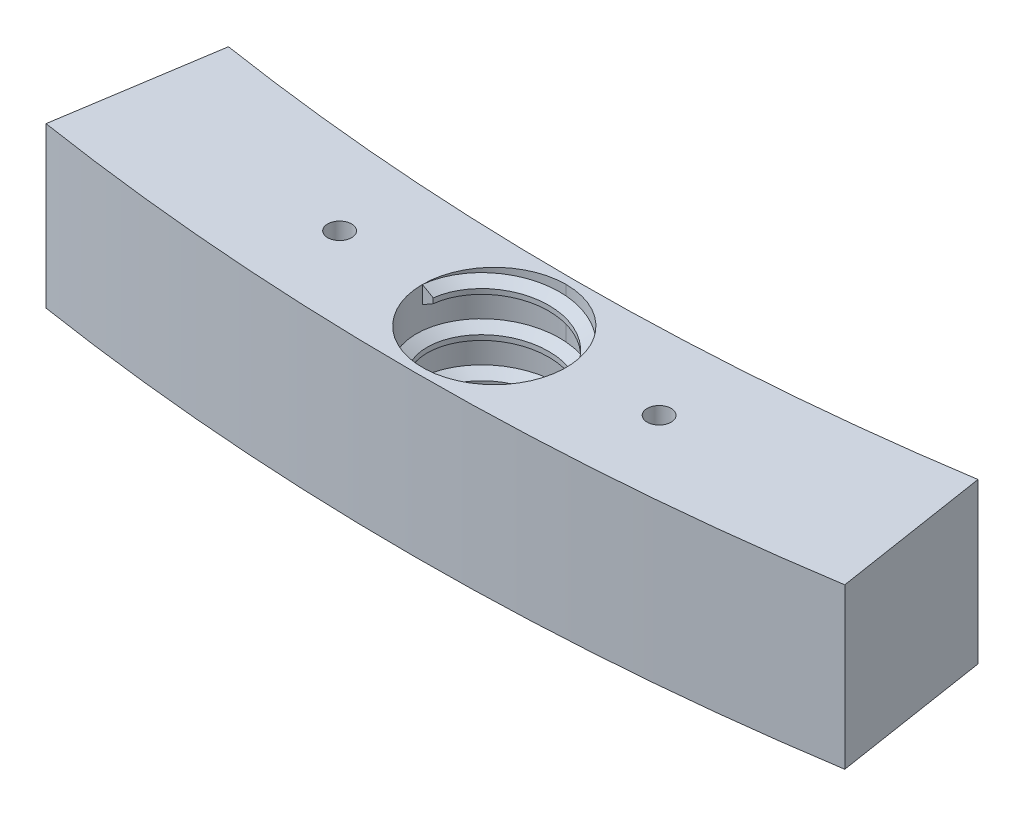
from build123d import *

# Parameters (mm, degrees)
SKETCH1_R           = 1.5
SKETCH1_R_2         = 9
BOSS_EXTRUDE1_DEPTH = 20
SKETCH3_R           = 9
BOSS_EXTRUDE2_DEPTH = 2
THREAD1_PITCH       = 5


with BuildPart() as part:
    # Sketch1 → Boss-Extrude1 (new body)
    with BuildSketch(Plane(origin=(0, 0, 0), x_dir=(1, 0, 0), z_dir=(0, 1, 0))):
        with BuildLine():
            ThreePointArc((-50, -320.624780702), (0, -324.5), (50, -320.624780702))
            Line((50, -320.624780702), (46.918335901, -300.863623185))
            ThreePointArc((46.918335901, -300.863623185), (0, -304.5), (-46.918335901, -300.863623185))
            Line((-46.918335901, -300.863623185), (-50, -320.624780702))
        make_face()
        with Locations(Location((-20, -313.863425713, 0), (0, 0, 270))):
            Circle(SKETCH1_R, mode=Mode.SUBTRACT)
        with Locations(Location((0, -314.5, 0), (0, 0, 270))):
            Circle(SKETCH1_R_2, mode=Mode.SUBTRACT)
        with Locations(Location((20, -313.863425713, 0), (0, 0, 270))):
            Circle(SKETCH1_R, mode=Mode.SUBTRACT)
    extrude(amount=BOSS_EXTRUDE1_DEPTH)

    # Sketch3 → Boss-Extrude2 (add)
    with BuildSketch(Plane(origin=(0, 0, 0), x_dir=(-1, 0, 0), z_dir=(0, -1, 0))):
        with Locations(Location((0, -314.5, 0), (0, 0, 90))):
            Circle(SKETCH3_R)
    extrude(amount=-BOSS_EXTRUDE2_DEPTH)

    # Thread1: arcs per turn and ends read off the stored shape
    # Thread1: the profile of Thread Profile1 profile screwed along a right-hand helix through 3.100003 turns, 12 arcs to a turn; built about Z, then put on its axis
    thread1_z = Axis((0, 0, 0), (0, 0, 1))
    thread1_corners = [(9.0003, 0, -0.000173205), (9.0003, 0, 2.187673198), (7.646835313, 0, 1.406249997), (7.646835313, 0, 0.781249997)]
    with BuildLine(mode=Mode.PRIVATE) as thread1_profile:
        Line(thread1_corners[0], thread1_corners[1])
        Line(thread1_corners[1], thread1_corners[2])
        Line(thread1_corners[2], thread1_corners[3])
        Line(thread1_corners[3], thread1_corners[0])
    thread1_cap = Face(thread1_profile.wire())
    thread1_turn_angles = [0, 15, 30, 45, 60, 75, 90, 105, 120, 135, 150, 165, 180, 195, 210, 225, 240, 255, 270, 285, 300, 315, 330, 345, 360]
    thread1_turn_weights = [1, 0.9659258262890683, 1, 0.9659258262890683, 1, 0.9659258262890683, 1, 0.9659258262890683, 1, 0.9659258262890683, 1, 0.9659258262890683, 1, 0.9659258262890683, 1, 0.9659258262890683, 1, 0.9659258262890683, 1, 0.9659258262890683, 1, 0.9659258262890683, 1, 0.9659258262890683, 1]
    thread1_turn_rails = [Edge.make_bspline([Vector(p[0], p[1], 0).rotate(thread1_z, thread1_turn_angles[k]) / thread1_turn_weights[k] + Vector(0, 0, p[2] + THREAD1_PITCH * thread1_turn_angles[k] / 360) for k in range(25)], [0, 0, 0, 1, 1, 2, 2, 3, 3, 4, 4, 5, 5, 6, 6, 7, 7, 8, 8, 9, 9, 10, 10, 11, 11, 12, 12, 12], 2, thread1_turn_weights) for p in thread1_corners]
    thread1_turn_sides = [Face.make_surface_from_curves(thread1_turn_rails[p[0]], thread1_turn_rails[p[1]]) for p in [(0, 1), (1, 2), (2, 3), (3, 0)]]
    thread1_last_angles = [1080, 1095, 1110, 1113.0005, 1116.001]
    thread1_last_weights = [1, 0.9659258262890683, 1, 0.9986290779991721, 1]
    thread1_last_rails = [Edge.make_bspline([Vector(p[0], p[1], 0).rotate(thread1_z, thread1_last_angles[k]) / thread1_last_weights[k] + Vector(0, 0, p[2] + THREAD1_PITCH * thread1_last_angles[k] / 360) for k in range(5)], [0, 0, 0, 1, 1, 2, 2, 2], 2, thread1_last_weights) for p in thread1_corners]
    thread1_last_sides = [Face.make_surface_from_curves(thread1_last_rails[p[0]], thread1_last_rails[p[1]]) for p in [(0, 1), (1, 2), (2, 3), (3, 0)]]
    thread1 = Plane(origin=(0, 20, 314.5), x_dir=(-1, 0, 0), z_dir=(0, -1, 0)) * Solid(Shell([*[p.moved(Location((0, 0, THREAD1_PITCH * i))) for i in range(3) for p in thread1_turn_sides], *thread1_last_sides, thread1_cap, thread1_cap.rotate(thread1_z, 1116.001).moved(Location((0, 0, THREAD1_PITCH * 1116.001 / 360)))]))
    add(thread1)


solid = part.part
